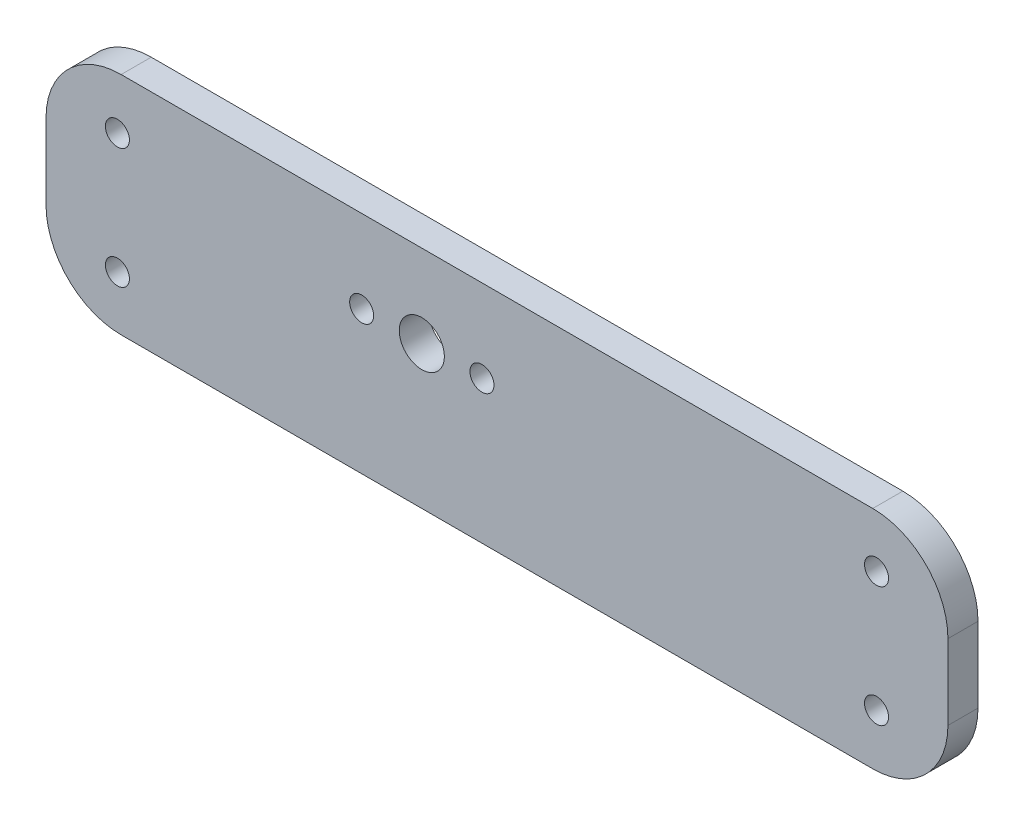
from build123d import *

# Parameters (mm, degrees)
ESBO_O1_W                = 120
ESBO_O1_H                = 30
ESBO_O1_R                = 3
ESBO_O1_R_2              = 1.6
RESSALTO_EXTRUS_O1_DEPTH = 4
FILETE1_R                = 10


with BuildPart() as part:
    # Esboço1 → Ressalto-extrusão1 (new body)
    with BuildSketch(Plane.XY):
        Rectangle(ESBO_O1_W, ESBO_O1_H)
        with Locations((-10, 4)):
            Circle(ESBO_O1_R, mode=Mode.SUBTRACT)
        with Locations((-2, 4)):
            Circle(ESBO_O1_R_2, mode=Mode.SUBTRACT)
        with Locations((-18, 4)):
            Circle(ESBO_O1_R_2, mode=Mode.SUBTRACT)
        with Locations((-50.5, 8)):
            Circle(ESBO_O1_R_2, mode=Mode.SUBTRACT)
        with Locations((-50.5, -8)):
            Circle(ESBO_O1_R_2, mode=Mode.SUBTRACT)
        with Locations((50.5, -8)):
            Circle(ESBO_O1_R_2, mode=Mode.SUBTRACT)
        with Locations((50.5, 8)):
            Circle(ESBO_O1_R_2, mode=Mode.SUBTRACT)
    extrude(amount=RESSALTO_EXTRUS_O1_DEPTH)

    # Filete1
    filete1_edges = [part.edges().sort_by_distance(p)[0] for p in [
        (-60, 15, 2),
        (-60, -15, 2),
        (60, -15, 2),
        (60, 15, 2),
    ]]
    fillet(filete1_edges, radius=FILETE1_R)


solid = part.part
